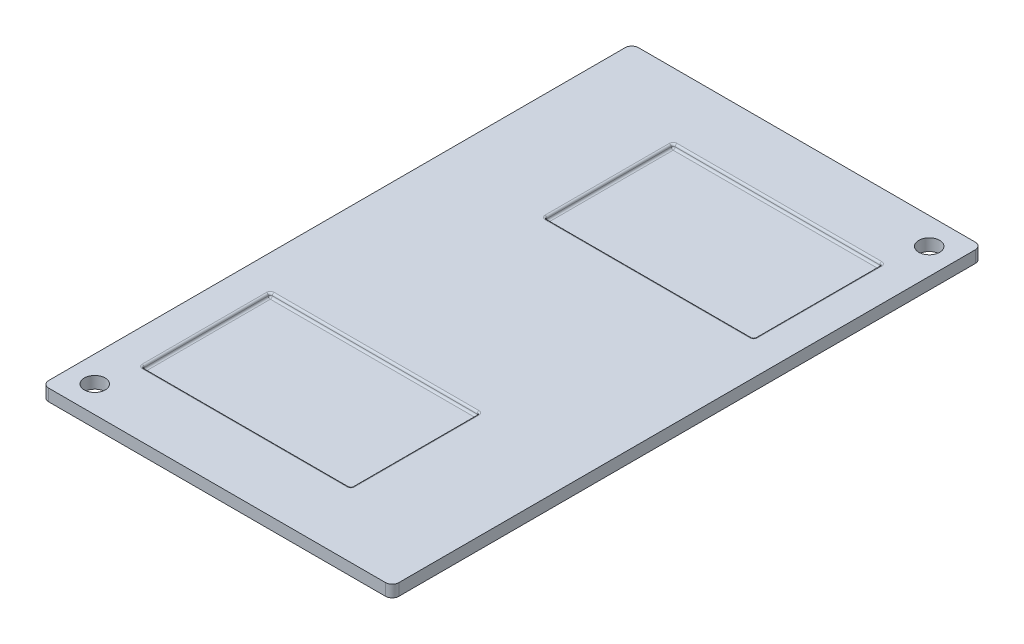
from build123d import *

# Parameters (mm, degrees)
EXTRUDE1_DEPTH     = 2.54
SKETCH2_W          = 44.45
SKETCH2_H          = 27.305
EXTRUDE2_DEPTH     = 0.8382
FILLET1_R          = 0.4191
SKETCH3_R          = 2.2225
CUT_EXTRUDE1_DEPTH = 74.109188914


with BuildPart() as part:
    # Sketch1 → Extrude1 (new body)
    with BuildSketch(Plane(origin=(0, 0, 0), x_dir=(1, 0, 0), z_dir=(0, 1, 0))):
        with BuildLine():
            Line((-35.8775, -62.8269), (35.8775, -62.8269))
            ThreePointArc((35.8775, -62.8269), (36.883288686, -62.410288686), (37.2999, -61.4045))
            Line((37.2999, -61.4045), (37.2999, 61.4045))
            ThreePointArc((37.2999, 61.4045), (36.883288686, 62.410288686), (35.8775, 62.8269))
            Line((35.8775, 62.8269), (-35.8775, 62.8269))
            ThreePointArc((-35.8775, 62.8269), (-36.883288686, 62.410288686), (-37.2999, 61.4045))
            Line((-37.2999, 61.4045), (-37.2999, -61.4045))
            ThreePointArc((-37.2999, -61.4045), (-36.883288686, -62.410288686), (-35.8775, -62.8269))
        make_face()
    extrude(amount=EXTRUDE1_DEPTH)

    # Sketch2 → Extrude2 (cut)
    with BuildSketch(Plane(origin=(0, 2.54, 0), x_dir=(1, 0, 0), z_dir=(0, 1, 0))):
        with Locations((7.7089, 35.2044)):
            Rectangle(SKETCH2_W, SKETCH2_H)
        with Locations((-7.7089, -35.2044)):
            Rectangle(SKETCH2_W, SKETCH2_H)
    extrude(amount=-EXTRUDE2_DEPTH, mode=Mode.SUBTRACT)

    # Fillet1
    fillet1_edges = [part.edges().sort_by_distance(p)[0] for p in [
        (-14.5161, 1.7018, -35.2044),
        (-14.5161, 2.1209, -21.5519),
        (7.7089, 1.7018, -48.8569),
        (-14.5161, 2.1209, -48.8569),
        (29.9339, 1.7018, -35.2044),
        (29.9339, 2.1209, -48.8569),
        (7.7089, 1.7018, -21.5519),
        (29.9339, 2.1209, -21.5519),
        (-14.5161, 2.54, -35.2044),
        (7.7089, 2.54, -21.5519),
        (29.9339, 2.54, -35.2044),
        (7.7089, 2.54, -48.8569),
        (-29.9339, 1.7018, 35.2044),
        (-29.9339, 2.1209, 48.8569),
        (-7.7089, 1.7018, 21.5519),
        (-29.9339, 2.1209, 21.5519),
        (14.5161, 1.7018, 35.2044),
        (14.5161, 2.1209, 21.5519),
        (-7.7089, 1.7018, 48.8569),
        (14.5161, 2.1209, 48.8569),
        (-29.9339, 2.54, 35.2044),
        (-7.7089, 2.54, 48.8569),
        (14.5161, 2.54, 35.2044),
        (-7.7089, 2.54, 21.5519),
    ]]
    fillet(fillet1_edges, radius=FILLET1_R - 0.0001)  # a hair under: the kernel refuses the full size

    # Sketch3 → Cut-Extrude1 (cut, through all)
    with BuildSketch(Plane(origin=(0, 2.54, 0), x_dir=(1, 0, 0), z_dir=(0, 1, 0))):
        with Locations(Location((31.75, 57.15, 0), (0, 0, 270))):
            Circle(SKETCH3_R)
        with Locations(Location((-31.75, -57.15, 0), (0, 0, 270))):
            Circle(SKETCH3_R)
    extrude(amount=-CUT_EXTRUDE1_DEPTH, mode=Mode.SUBTRACT)


solid = part.part
